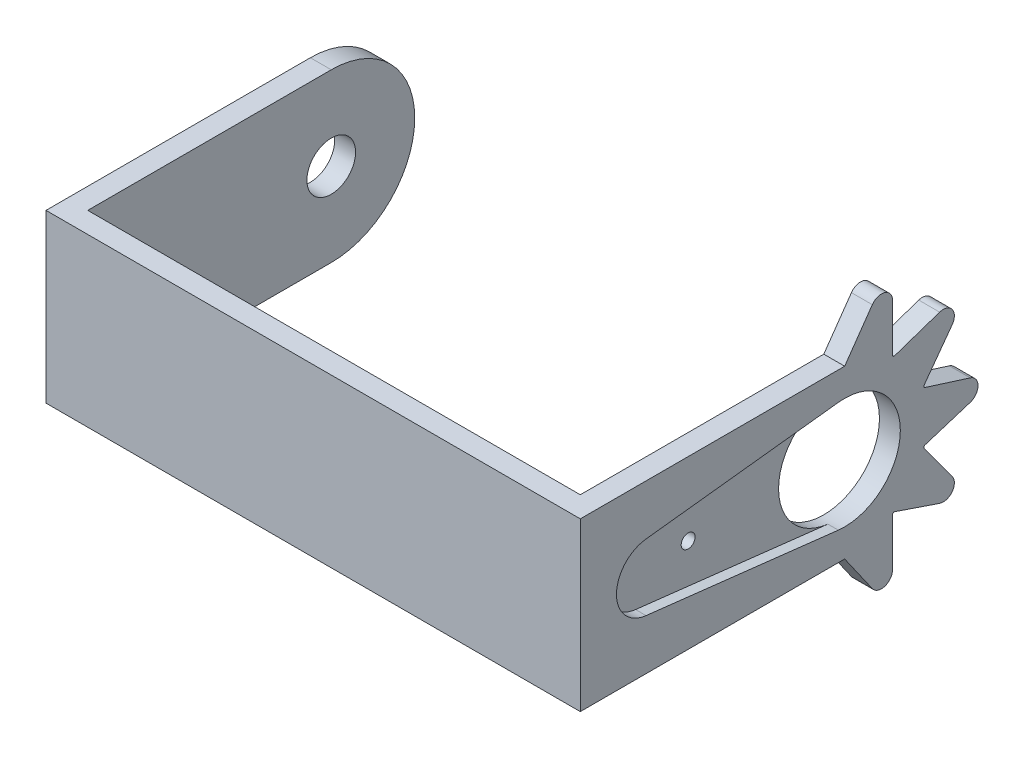
from build123d import *

# Parameters (mm, degrees)
EXTRUDE_2_DEPTH     = 12
FILLET_1_R          = 6
CUT_EXTRUDE_1_DEPTH = 0.75
CUT_EXTRUDE_2_REACH = 48.76
SKETCH_4_R          = 4
CUT_EXTRUDE_3_REACH = 49.366
SKETCH_5_R          = 1.75
CUT_EXTRUDE_4_REACH = 48.76
SKETCH_6_R          = 0.5
EXTRUDE_4_DEPTH     = 1.5


with BuildPart() as part:
    # 草图2 → 凸台-拉伸2 (new body)
    with BuildSketch(Plane(origin=(0, 0, 0), x_dir=(1, 0, 0), z_dir=(0, 1, 0))):
        Polygon((0, 0), (38.4, 0), (38.4, 25), (36.9, 25), (36.9, 1.5), (1.5, 1.5), (1.5, 25), (0, 25), align=None)
    extrude(amount=EXTRUDE_2_DEPTH)

    # 圆角1
    fillet_1_edges = [part.edges().sort_by_distance(p)[0] for p in [
        (0.75, 0, -25),
        (0.75, 12, -25),
        (37.65, 0, -25),
        (37.65, 12, -25),
    ]]
    fillet(fillet_1_edges, radius=FILLET_1_R - 0.0001)  # a hair under: the kernel refuses the full size

    # 草图3 → 切除-拉伸1 (cut)
    with BuildSketch(Plane(origin=(38.4, 0, 0), x_dir=(0, 0, -1), z_dir=(1, 0, 0))):
        with BuildLine():
            Line((18.542857143, 9.973791692), (4.725714286, 8.384275015))
            ThreePointArc((4.725714286, 8.384275015), (2.6, 6), (4.725714286, 3.615724985))
            Line((4.725714286, 3.615724985), (18.542857143, 2.026208308))
            ThreePointArc((18.542857143, 2.026208308), (23, 6), (18.542857143, 9.973791692))
        make_face()
    extrude(amount=-CUT_EXTRUDE_1_DEPTH, mode=Mode.SUBTRACT)

    # 草图4 → 切除-拉伸2 (cut, up to next)
    with BuildSketch(Plane(origin=(37.65, 0, 0), x_dir=(0, 0, -1), z_dir=(1, 0, 0)), mode=Mode.PRIVATE) as cut_extrude_2_sk1:
        with Locations((19, 6)):
            Circle(SKETCH_4_R)
    cut_extrude_2_tool1 = extrude(cut_extrude_2_sk1.sketch, amount=-CUT_EXTRUDE_2_REACH, mode=Mode.PRIVATE) & part.part
    add(cut_extrude_2_tool1.solids().sort_by_distance((37.65, 6, -19))[0], mode=Mode.SUBTRACT)

    # 草图5 → 切除-拉伸3 (cut, up to next)
    with BuildSketch(Plane.ZY, mode=Mode.PRIVATE) as cut_extrude_3_sk1:
        with Locations((-19, 6)):
            Circle(SKETCH_5_R)
    cut_extrude_3_tool1 = extrude(cut_extrude_3_sk1.sketch, amount=-CUT_EXTRUDE_3_REACH, mode=Mode.PRIVATE) & part.part
    add(cut_extrude_3_tool1.solids().sort_by_distance((0, 6, -19))[0], mode=Mode.SUBTRACT)

    # 草图6 → 切除-拉伸4 (cut, up to next)
    with BuildSketch(Plane(origin=(37.65, 0, 0), x_dir=(0, 0, -1), z_dir=(1, 0, 0)), mode=Mode.PRIVATE) as cut_extrude_4_sk1:
        with Locations((8.5, 6)):
            Circle(SKETCH_6_R)
    cut_extrude_4_tool1 = extrude(cut_extrude_4_sk1.sketch, amount=-CUT_EXTRUDE_4_REACH, mode=Mode.PRIVATE) & part.part
    add(cut_extrude_4_tool1.solids().sort_by_distance((37.65, 6, -8.5))[0], mode=Mode.SUBTRACT)

    # 草图7 → 凸台-拉伸4 (add)
    with BuildSketch(Plane(origin=(38.4, 0, 0), x_dir=(0, 0, -1), z_dir=(1, 0, 0))):
        with BuildLine():
            Line((19, 12), (20.986136983, 14.836497573))
            ThreePointArc((20.986136983, 14.836497573), (21.882023258, 15.140609984), (22.441458618, 14.377636424))
            Line((22.441458618, 14.377636424), (22.441458618, 10.914912266))
            ThreePointArc((22.441458618, 10.914912266), (20.804234797, 11.722301704), (19, 12))
        make_face()
        with BuildLine():
            Line((26.729122981, 10.721132005), (24.681580777, 7.928636792))
            ThreePointArc((24.681580777, 7.928636792), (23.838667626, 9.54785789), (22.54785789, 10.838667626))
            Line((22.54785789, 10.838667626), (25.826815726, 11.951723827))
            ThreePointArc((25.826815726, 11.951723827), (26.729122981, 11.667227443), (26.729122981, 10.721132005))
        make_face()
        with BuildLine():
            Line((28.02476043, 5.237026439), (24.722301704, 4.195765203))
            ThreePointArc((24.722301704, 4.195765203), (25, 6), (24.722301704, 7.804234797))
            Line((24.722301704, 7.804234797), (28.02476043, 6.762973561))
            ThreePointArc((28.02476043, 6.762973561), (28.58419579, 6), (28.02476043, 5.237026439))
        make_face()
        with BuildLine():
            Line((25.826815726, 0.048276173), (22.54785789, 1.161332374))
            ThreePointArc((22.54785789, 1.161332374), (23.838667626, 2.45214211), (24.681580777, 4.071363208))
            Line((24.681580777, 4.071363208), (26.729122981, 1.278867995))
            ThreePointArc((26.729122981, 1.278867995), (26.729122981, 0.332772557), (25.826815726, 0.048276173))
        make_face()
        with BuildLine():
            Line((20.986136983, -2.836497573), (19, 0))
            ThreePointArc((19, 0), (20.804234797, 0.277698296), (22.441458618, 1.085087734))
            Line((22.441458618, 1.085087734), (22.441458618, -2.377636424))
            ThreePointArc((22.441458618, -2.377636424), (21.882023258, -3.140609984), (20.986136983, -2.836497573))
        make_face()
    extrude(amount=-EXTRUDE_4_DEPTH)


solid = part.part
